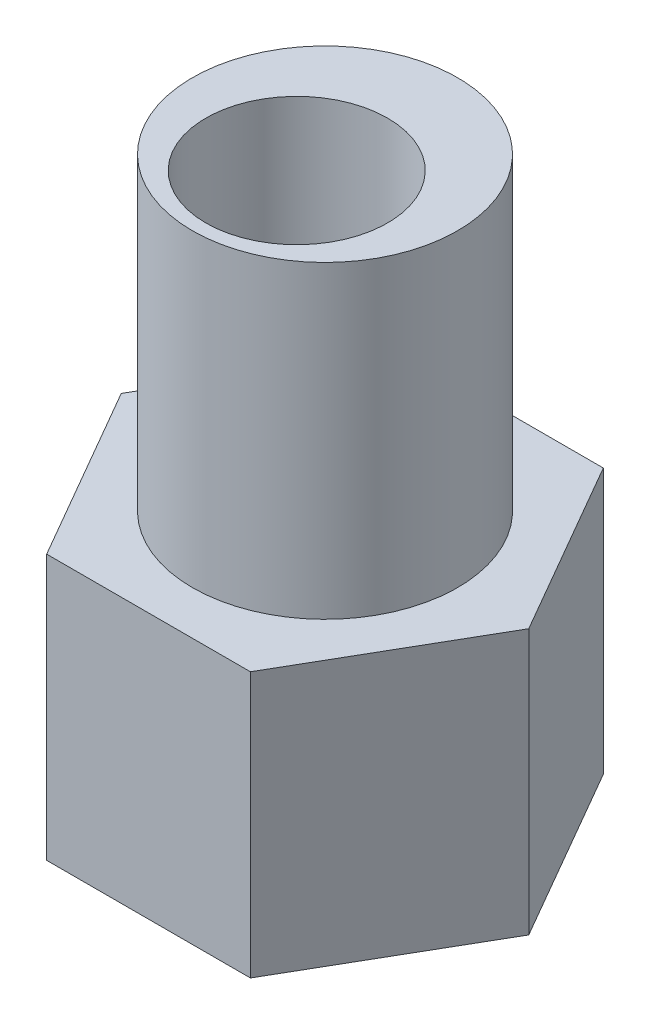
from build123d import *

# Parameters (mm, degrees)
BOSS_EXTRUDE1_OUTLINE_R = 3.2639
BOSS_EXTRUDE1_DEPTH     = 20.6248
SKETCH2_OUTSIDE_W       = 22.294
SKETCH2_OUTSIDE_H       = 20.332
SKETCH2_OUTSIDE_R       = 4.7625
CUT_EXTRUDE2_DEPTH      = 11.0998


# Read off the part's stored shape, not the designer's step: Boss-Extrude1
with BuildPart() as part:
    # Boss-Extrude1 outline → Boss-Extrude1 (new body)
    with BuildSketch(Plane(origin=(0, 0, 0), x_dir=(1, 0, 0), z_dir=(0, 1, 0))):
        Polygon((3.658841861, -6.3373), (7.317683722, 0), (3.658841861, 6.3373), (-3.658841861, 6.3373), (-7.317683722, 0), (-3.658841861, -6.3373), align=None)
        with Locations((0, -1.016)):
            Circle(BOSS_EXTRUDE1_OUTLINE_R, mode=Mode.SUBTRACT)
    extrude(amount=BOSS_EXTRUDE1_DEPTH)

    # Sketch2 outside → Cut-Extrude2 (cut)
    with BuildSketch(Plane(origin=(0, 20.6248, 0), x_dir=(1, 0, 0), z_dir=(0, 1, 0))):
        Rectangle(SKETCH2_OUTSIDE_W, SKETCH2_OUTSIDE_H)
        with Locations(Location((0, 0, 0), (0, 0, 270))):
            Circle(SKETCH2_OUTSIDE_R, mode=Mode.SUBTRACT)
    extrude(amount=-CUT_EXTRUDE2_DEPTH, mode=Mode.SUBTRACT)


solid = part.part
